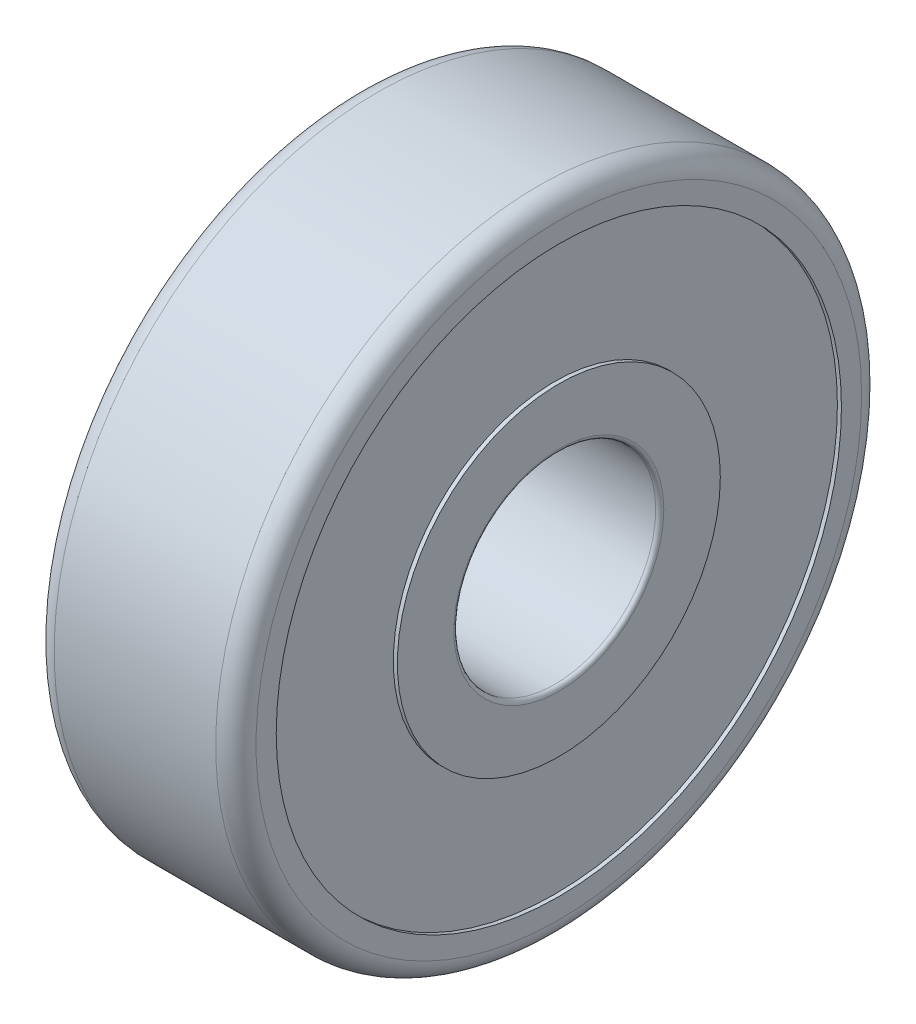
from build123d import *

# Parameters (mm, degrees)
SALIENTE_EXTRUIR2_DEPTH      = 2.5
SALIENTE_EXTRUIR2_DEPTH_BACK = 2.5
CROQUIS2_R                   = 8
CROQUIS2_R_2                 = 2.5
REDONDEO1_R                  = 0.5
REDONDEO2_R                  = 0.1
CROQUIS3_R                   = 7
CROQUIS3_R_2                 = 4
CORTAR_EXTRUIR1_DEPTH        = 0.1
CORTAR_EXTRUIR2_START        = -0.1
CROQUIS4_R                   = 7
CROQUIS4_R_2                 = 4
CORTAR_EXTRUIR2_DEPTH        = 0.1


with BuildPart() as part:
    # Croquis2 → Saliente-Extruir2 (new, two sides: drawn at the far end of the back side and taken through both)
    with BuildSketch(Plane(origin=(0, 0, 0), x_dir=(0, 0, -1), z_dir=(1, 0, 0)).offset(-SALIENTE_EXTRUIR2_DEPTH_BACK)):
        Circle(CROQUIS2_R)
        Circle(CROQUIS2_R_2, mode=Mode.SUBTRACT)
    extrude(amount=SALIENTE_EXTRUIR2_DEPTH + SALIENTE_EXTRUIR2_DEPTH_BACK)

    # Redondeo1
    redondeo1_edges = [part.edges().sort_by_distance(p)[0] for p in [
        (2.5, 0, 8),
        (-2.5, 0, 8),
    ]]
    fillet(redondeo1_edges, radius=REDONDEO1_R)

    # Redondeo2
    redondeo2_edges = [part.edges().sort_by_distance(p)[0] for p in [
        (-2.5, 0, 2.5),
        (2.5, 0, 2.5),
    ]]
    fillet(redondeo2_edges, radius=REDONDEO2_R)

    # Croquis3 → Cortar-Extruir1 (cut)
    with BuildSketch(Plane.ZY.offset(2.5)):
        Circle(CROQUIS3_R)
        Circle(CROQUIS3_R_2, mode=Mode.SUBTRACT)
    extrude(amount=-CORTAR_EXTRUIR1_DEPTH, mode=Mode.SUBTRACT)

    # Croquis4 → Cortar-Extruir2 (cut)
    with BuildSketch(Plane(origin=(2.5, 0, 0), x_dir=(0, 0, -1), z_dir=(1, 0, 0)).offset(CORTAR_EXTRUIR2_START)):
        Circle(CROQUIS4_R)
        Circle(CROQUIS4_R_2, mode=Mode.SUBTRACT)
    extrude(amount=CORTAR_EXTRUIR2_DEPTH, mode=Mode.SUBTRACT)


solid = part.part
